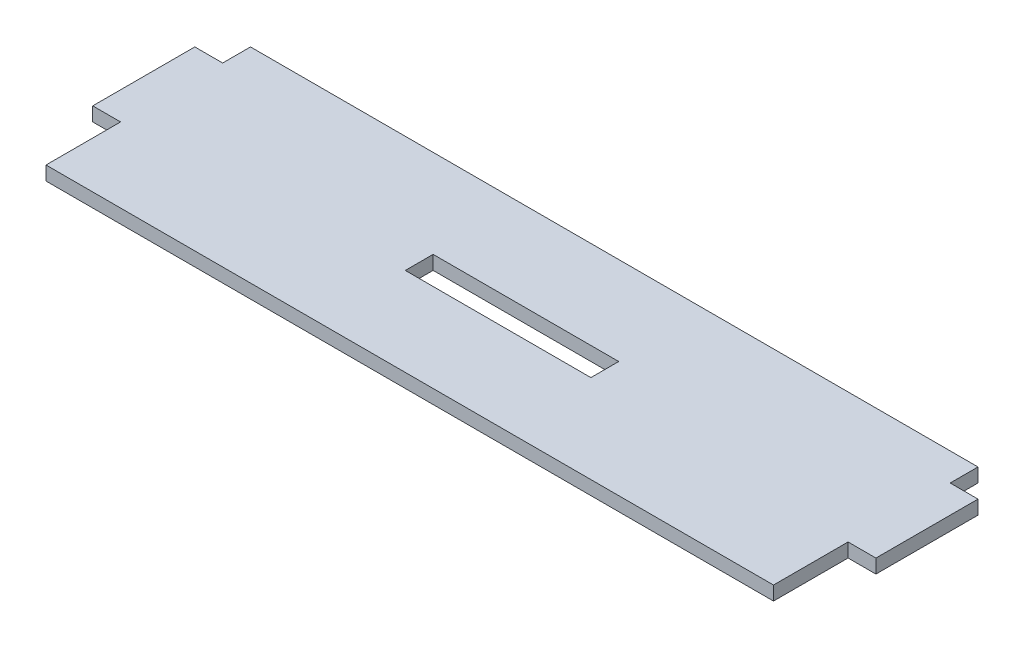
from build123d import *

# Parameters (mm, degrees)
SKETCH2_W           = 40
SKETCH2_H           = 6
BOSS_EXTRUDE1_DEPTH = 3


with BuildPart() as part:
    # Sketch2 → Boss-Extrude1 (new body)
    with BuildSketch(Plane(origin=(0, 0, 0), x_dir=(1, 0, 0), z_dir=(0, 1, 0))):
        Polygon((0, -6), (-6, -6), (-6, -28), (0, -28), (0, -44.07), (156.78, -44.07), (156.78, -28), (162.78, -28), (162.78, -6), (156.78, -6), (156.78, 0), (0, 0), align=None)
        with Locations((78.39, -22.035)):
            Rectangle(SKETCH2_W, SKETCH2_H, mode=Mode.SUBTRACT)
    extrude(amount=BOSS_EXTRUDE1_DEPTH)


solid = part.part
